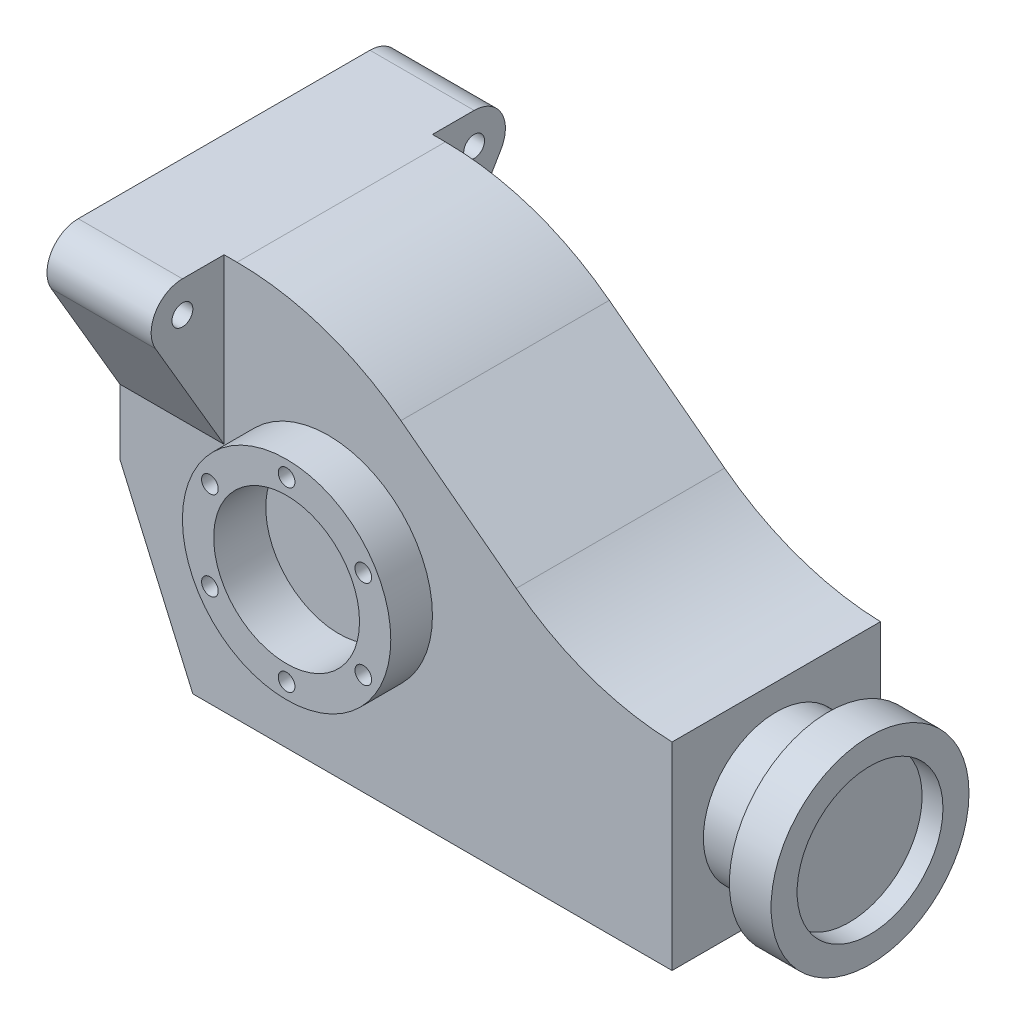
from build123d import *

# Parameters (mm, degrees)
DODANIE_WYCI_GNI_CIE1_DEPTH = 50
SZKIC2_R                    = 35
DODANIE_WYCI_GNI_CIE2_DEPTH = 25
SZKIC3_R                    = 47.5
DODANIE_WYCI_GNI_CIE3_DEPTH = 20
SZKIC7_R                    = 50
DODANIE_WYCI_GNI_CIE5_DEPTH = 20
SZKIC8_R                    = 35
WYTNIJ_WYCI_GNI_CIE1_DEPTH  = 25
SZKIC9_R                    = 4
WYTNIJ_WYCI_GNI_CIE2_DEPTH  = 15
SZKIC12_R                   = 5
DODANIE_WYCI_GNI_CIE6_DEPTH = 50
ZAOKR_GLENIE2_R             = 130
ZAOKR_GLENIE3_R             = 130
SZKIC4_R                    = 35
WYTNIJ_WYCI_GNI_CIE3_DEPTH  = 10


with BuildPart() as part:
    # Szkic1 → Dodanie-wyciągnięcie1 (new, symmetric)
    with BuildSketch(Plane.XY):
        Polygon((-35, 190), (65, 190), (190, 95), (230, 95), (230, 0), (0, 0), (-35, 80), align=None)
    extrude(amount=DODANIE_WYCI_GNI_CIE1_DEPTH, both=True)

    # Szkic7 → Dodanie-wyciągnięcie5 (add)
    with BuildSketch(Plane.XY.offset(50)):
        with Locations((65, 90)):
            Circle(SZKIC7_R)
    dodanie_wyci_gni_cie5 = extrude(amount=DODANIE_WYCI_GNI_CIE5_DEPTH)

    # Szkic8 → Wytnij-wyciągnięcie1 (cut)
    with BuildSketch(Plane.XY.offset(70)):
        with Locations((65, 90)):
            Circle(SZKIC8_R)
    wytnij_wyci_gni_cie1 = extrude(amount=-WYTNIJ_WYCI_GNI_CIE1_DEPTH, mode=Mode.SUBTRACT)

    # Szkic9 → Wytnij-wyciągnięcie2 (cut)
    with BuildSketch(Plane.XY.offset(70)):
        with Locations((65, 132.5)):
            Circle(SZKIC9_R)
        with Locations((101.806079661, 111.25)):
            Circle(SZKIC9_R)
        with Locations((101.806079661, 68.75)):
            Circle(SZKIC9_R)
        with Locations((65, 47.5)):
            Circle(SZKIC9_R)
        with Locations((28.193920339, 68.75)):
            Circle(SZKIC9_R)
        with Locations((28.193920339, 111.25)):
            Circle(SZKIC9_R)
    wytnij_wyci_gni_cie2 = extrude(amount=-WYTNIJ_WYCI_GNI_CIE2_DEPTH, mode=Mode.SUBTRACT)

    # Szkic12 → Dodanie-wyciągnięcie6 (add)
    # profile 1 of 6: a face of its own
    with BuildSketch(Plane.ZY.offset(35)):
        with BuildLine():
            Line((-50, 190), (-70, 190))
            ThreePointArc((-70, 190), (-83.014439461, 182.458174409), (-82.941861244, 167.416582068))
            Line((-82.941861244, 167.416582068), (-50, 111.198000795))
            Line((-50, 111.198000795), (-50, 190))
        make_face()
        with Locations(Location((-70, 175, 0), (0, 0, 270))):
            Circle(SZKIC12_R, mode=Mode.SUBTRACT)
    # profile 2 of 6: a face of its own
    with BuildSketch(Plane.ZY.offset(35)):
        Polygon((0, 190), (-50, 190), (-50, 111.198000795), (-31.7192076, 80), (0, 80), align=None)
    # profile 3 of 6: a face of its own
    with BuildSketch(Plane.ZY.offset(35)):
        Polygon((50, 190), (0, 190), (0, 80), (31.7192076, 80), (50, 111.198000795), align=None)
    # profile 4 of 6: a face of its own
    with BuildSketch(Plane.ZY.offset(35)):
        with BuildLine():
            Line((70, 190), (50, 190))
            Line((50, 190), (50, 111.198000795))
            Line((50, 111.198000795), (82.941861244, 167.416582068))
            ThreePointArc((82.941861244, 167.416582068), (83.014439461, 182.458174409), (70, 190))
        make_face()
        with Locations(Location((70, 175, 0), (0, 0, 270))):
            Circle(SZKIC12_R, mode=Mode.SUBTRACT)
    # profile 5 of 6: a face of its own
    with BuildSketch(Plane.ZY.offset(35)):
        Polygon((31.7192076, 80), (0, 80), (0, 60), (20, 60), align=None)
    # profile 6 of 6: a face of its own
    with BuildSketch(Plane.ZY.offset(35)):
        Polygon((0, 60), (0, 80), (-31.7192076, 80), (-20, 60), align=None)
    extrude(amount=-DODANIE_WYCI_GNI_CIE6_DEPTH)

    # Lustro1: Dodanie-wyciągnięcie5, Wytnij-wyciągnięcie1, Wytnij-wyciągnięcie2 across plane
    add(dodanie_wyci_gni_cie5.mirror(Plane.XY))
    add(wytnij_wyci_gni_cie1.mirror(Plane.XY), mode=Mode.SUBTRACT)
    add(wytnij_wyci_gni_cie2.mirror(Plane.XY), mode=Mode.SUBTRACT)

    # Zaokrąglenie2
    zaokr_glenie2_edges = [part.edges().sort_by_distance(p)[0] for p in [
        (65, 190, 0),
    ]]
    fillet(zaokr_glenie2_edges, radius=ZAOKR_GLENIE2_R)

    # Zaokrąglenie3
    # the kernel refuses this fillet: 130 mm, written as the material it adds along each edge
    with BuildSketch(Plane(origin=(190, 95, 50), x_dir=(-0.7961621941231027, 0.6050832675335577, 0), z_dir=(0, 0, -1))) as zaokr_glenie3_piece_1:
        with BuildLine():
            CenterArc((43.698629651, 130), ZAOKR_GLENIE3_R, 234.470905265, 35.529094735)
            Line((-31.846487765, 24.203330701), (-33.357390113, 22.087397315))
            ThreePointArc((-33.357390113, 22.087397315), (-17.496460378, 10.031643646), (-1.573216496, -2.070021705))
            Line((-1.573216496, -2.070021705), (0, -2.6))
            Line((0, -2.6), (43.698629651, -2.6))
            Line((43.698629651, -2.6), (43.698629651, 0))
        make_face()
    extrude(amount=100)


with BuildPart() as body_2:
    # Szkic2 → Dodanie-wyciągnięcie2 (new body)
    with BuildSketch(Plane(origin=(230, 0, 0), x_dir=(0, 0, -1), z_dir=(1, 0, 0))):
        with Locations((0, 47.5)):
            Circle(SZKIC2_R)
    extrude(amount=DODANIE_WYCI_GNI_CIE2_DEPTH)

    # Szkic3 → Dodanie-wyciągnięcie3 (add)
    with BuildSketch(Plane(origin=(255, 0, 0), x_dir=(0, 0, -1), z_dir=(1, 0, 0))):
        with Locations((0, 47.5)):
            Circle(SZKIC3_R)
    extrude(amount=DODANIE_WYCI_GNI_CIE3_DEPTH)

    # Szkic4 → Wytnij-wyciągnięcie3 (cut)
    with BuildSketch(Plane(origin=(275, 0, 0), x_dir=(0, 0, -1), z_dir=(1, 0, 0))):
        with Locations((0, 47.5)):
            Circle(SZKIC4_R)
    extrude(amount=-WYTNIJ_WYCI_GNI_CIE3_DEPTH, mode=Mode.SUBTRACT)


solid = Compound([part.part, body_2.part])
